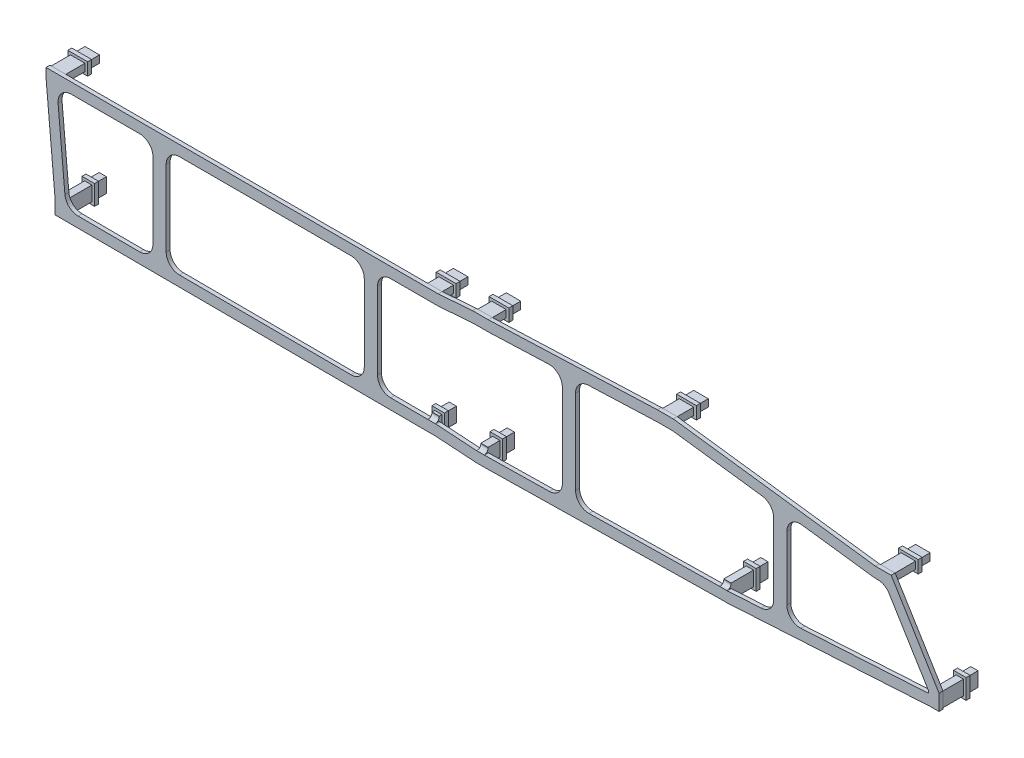
from build123d import *

# Parameters (mm, degrees)
STUD_LINK_DEPTH                  = 3
SKETCH1_W                        = 11
SKETCH1_H                        = 5.5
BOSS_EXTRUDE1_DEPTH              = 8
BOSS_EXTRUDE1_DIRECTION_2_REACH  = 398.6
SKETCH2_W                        = 11
SKETCH2_H                        = 5.5
BOSS_EXTRUDE2_DEPTH              = 8
BOSS_EXTRUDE2_DIRECTION_2_REACH  = 398.681
SKETCH3_W                        = 11
SKETCH3_H                        = 5.5
BOSS_EXTRUDE3_DEPTH              = 8
BOSS_EXTRUDE3_DIRECTION_2_REACH  = 398.771
SKETCH4_W                        = 5.5
SKETCH4_H                        = 11
BOSS_EXTRUDE4_DEPTH              = 8
BOSS_EXTRUDE4_DIRECTION_2_REACH  = 398.771
SKETCH5_W                        = 5.5
SKETCH5_H                        = 11
BOSS_EXTRUDE5_DEPTH              = 8
BOSS_EXTRUDE5_DIRECTION_2_REACH  = 398.6
SKETCH6_W                        = 5.5
SKETCH6_H                        = 11
BOSS_EXTRUDE6_DEPTH              = 8
BOSS_EXTRUDE6_DIRECTION_2_REACH  = 398.983
SKETCH7_W                        = 11
SKETCH7_H                        = 5.5
BOSS_EXTRUDE7_DEPTH              = 8
BOSS_EXTRUDE7_DIRECTION_2_REACH  = 398.926
SKETCH8_W                        = 5.5
SKETCH8_H                        = 11
BOSS_EXTRUDE8_DEPTH              = 8
BOSS_EXTRUDE8_DIRECTION_2_REACH  = 398.926
SKETCH9_W                        = 11
SKETCH9_H                        = 5.5
BOSS_EXTRUDE9_DEPTH              = 8
BOSS_EXTRUDE9_DIRECTION_2_REACH  = 398.872
BOSS_EXTRUDE10_DEPTH             = 22
BOSS_EXTRUDE10_DEPTH_BACK        = 8
SKETCH10_W                       = 5.5
SKETCH10_H                       = 11
SKETCH14_W                       = 15
SKETCH14_H                       = 9.5
BOSS_EXTRUDE14_DEPTH             = 3
SKETCH15_W                       = 15
SKETCH15_H                       = 9.5
BOSS_EXTRUDE15_DEPTH             = 3
SKETCH16_W                       = 15
SKETCH16_H                       = 9.5
BOSS_EXTRUDE16_DEPTH             = 3
SKETCH17_W                       = 9.5
SKETCH17_H                       = 15
BOSS_EXTRUDE17_DEPTH             = 3
SKETCH18_W                       = 9.5
SKETCH18_H                       = 15
BOSS_EXTRUDE18_DEPTH             = 3
SKETCH19_W                       = 9.5
SKETCH19_H                       = 15
BOSS_EXTRUDE19_DEPTH             = 3
SKETCH20_W                       = 15
SKETCH20_H                       = 9.5
BOSS_EXTRUDE20_DEPTH             = 3
SKETCH21_W                       = 9.5
SKETCH21_H                       = 15
BOSS_EXTRUDE21_DEPTH             = 3
SKETCH22_W                       = 15
SKETCH22_H                       = 9.5
BOSS_EXTRUDE22_DEPTH             = 3
SKETCH23_W                       = 9.5
SKETCH23_H                       = 15
BOSS_EXTRUDE23_DEPTH             = 3
CUT_EXTRUDE1_DEPTH               = 3
BOSS_EXTRUDE24_REACH             = 394.062
SKETCH25_W                       = 10
SKETCH25_H                       = 3
BOSS_EXTRUDE24_DIRECTION_2_REACH = 394.062
FILLET1_R                        = 3
FILLET2_R                        = 10


# Some blends are built 0.0001 mm under size
with BuildPart() as part:
    # Sketch13 → STUD LINK (new body)
    with BuildSketch(Plane.XY.offset(12)):
        Polygon((-277.75, -90), (-284.25, -90), (-284.25, -78), (-291, -3.25), (-291, 3.25), (-279, 3.25), (-6, 3.25), (6, 3.25), (32, 5.25), (44, 5.25), (172, 10.25), (184, 10.25), (337, -9.75), (349, -9.75), (385.25, -69), (385.25, -81), (378.75, -81), (225.25, -90), (218.75, -90), (41.25, -93), (34.75, -93), (4.25, -91), (-2.25, -91), align=None)
    extrude(amount=STUD_LINK_DEPTH)

    # Sketch1 → Boss-Extrude1 (add)
    with BuildSketch(Plane.XY):
        Rectangle(SKETCH1_W, SKETCH1_H)
    extrude(amount=-BOSS_EXTRUDE1_DEPTH)

    # Sketch1 → Boss-Extrude1 direction 2 (add, up to next)
    with BuildSketch(Plane.XY, mode=Mode.PRIVATE) as boss_extrude1_direction_2_sk1:
        Rectangle(SKETCH1_W, SKETCH1_H)
    boss_extrude1_direction_2_tool1 = extrude(boss_extrude1_direction_2_sk1.sketch, amount=BOSS_EXTRUDE1_DIRECTION_2_REACH, mode=Mode.PRIVATE) - part.part
    add(boss_extrude1_direction_2_tool1.solids().sort_by_distance((0, 0, 0))[0])


with BuildPart() as body_2:
    # Sketch2 → Boss-Extrude2 (new body)
    with BuildSketch(Plane.XY.offset(-2)):
        with Locations((38, 2)):
            Rectangle(SKETCH2_W, SKETCH2_H)
    extrude(amount=-BOSS_EXTRUDE2_DEPTH)


    # Sketch2 → Boss-Extrude2 direction 2 (add, up to next)
    with BuildSketch(Plane.XY.offset(-2), mode=Mode.PRIVATE) as boss_extrude2_direction_2_sk1:
        with Locations((38, 2)):
            Rectangle(SKETCH2_W, SKETCH2_H)
    boss_extrude2_direction_2_tool1 = extrude(boss_extrude2_direction_2_sk1.sketch, amount=BOSS_EXTRUDE2_DIRECTION_2_REACH, mode=Mode.PRIVATE) - part.part
    add(boss_extrude2_direction_2_tool1.solids().sort_by_distance((38, 2, -2))[0])



with BuildPart() as body_3:
    # Sketch3 → Boss-Extrude3 (new body)
    with BuildSketch(Plane.XY.offset(-4)):
        with Locations((178, 7)):
            Rectangle(SKETCH3_W, SKETCH3_H)
    extrude(amount=-BOSS_EXTRUDE3_DEPTH)


    # Sketch3 → Boss-Extrude3 direction 2 (add, up to next)
    with BuildSketch(Plane.XY.offset(-4), mode=Mode.PRIVATE) as boss_extrude3_direction_2_sk1:
        with Locations((178, 7)):
            Rectangle(SKETCH3_W, SKETCH3_H)
    boss_extrude3_direction_2_tool1 = extrude(boss_extrude3_direction_2_sk1.sketch, amount=BOSS_EXTRUDE3_DIRECTION_2_REACH, mode=Mode.PRIVATE) - part.part
    add(boss_extrude3_direction_2_tool1.solids().sort_by_distance((178, 7, -4))[0])



with BuildPart() as body_4:
    # Sketch4 → Boss-Extrude4 (new body)
    with BuildSketch(Plane.XY.offset(7)):
        with Locations((1, -85)):
            Rectangle(SKETCH4_W, SKETCH4_H)
    extrude(amount=-BOSS_EXTRUDE4_DEPTH)


    # Sketch4 → Boss-Extrude4 direction 2 (add, up to next)
    with BuildSketch(Plane.XY.offset(7), mode=Mode.PRIVATE) as boss_extrude4_direction_2_sk1:
        with Locations((1, -85)):
            Rectangle(SKETCH4_W, SKETCH4_H)
    boss_extrude4_direction_2_tool1 = extrude(boss_extrude4_direction_2_sk1.sketch, amount=BOSS_EXTRUDE4_DIRECTION_2_REACH, mode=Mode.PRIVATE) - part.part
    add(boss_extrude4_direction_2_tool1.solids().sort_by_distance((1, -85, 7))[0])



with BuildPart() as body_5:
    # Sketch5 → Boss-Extrude5 (new body)
    with BuildSketch(Plane.XY):
        with Locations((38, -87)):
            Rectangle(SKETCH5_W, SKETCH5_H)
    extrude(amount=-BOSS_EXTRUDE5_DEPTH)


    # Sketch5 → Boss-Extrude5 direction 2 (add, up to next)
    with BuildSketch(Plane.XY, mode=Mode.PRIVATE) as boss_extrude5_direction_2_sk1:
        with Locations((38, -87)):
            Rectangle(SKETCH5_W, SKETCH5_H)
    boss_extrude5_direction_2_tool1 = extrude(boss_extrude5_direction_2_sk1.sketch, amount=BOSS_EXTRUDE5_DIRECTION_2_REACH, mode=Mode.PRIVATE) - part.part
    add(boss_extrude5_direction_2_tool1.solids().sort_by_distance((38, -87, 0))[0])



with BuildPart() as body_6:
    # Sketch6 → Boss-Extrude6 (new body)
    with BuildSketch(Plane.XY.offset(-8)):
        with Locations((222, -84)):
            Rectangle(SKETCH6_W, SKETCH6_H)
    extrude(amount=-BOSS_EXTRUDE6_DEPTH)


    # Sketch6 → Boss-Extrude6 direction 2 (add, up to next)
    with BuildSketch(Plane.XY.offset(-8), mode=Mode.PRIVATE) as boss_extrude6_direction_2_sk1:
        with Locations((222, -84)):
            Rectangle(SKETCH6_W, SKETCH6_H)
    boss_extrude6_direction_2_tool1 = extrude(boss_extrude6_direction_2_sk1.sketch, amount=BOSS_EXTRUDE6_DIRECTION_2_REACH, mode=Mode.PRIVATE) - part.part
    add(boss_extrude6_direction_2_tool1.solids().sort_by_distance((222, -84, -8))[0])



with BuildPart() as body_7:
    # Sketch7 → Boss-Extrude7 (new body)
    with BuildSketch(Plane.XY.offset(-7)):
        with Locations((343, -13)):
            Rectangle(SKETCH7_W, SKETCH7_H)
    extrude(amount=-BOSS_EXTRUDE7_DEPTH)


    # Sketch7 → Boss-Extrude7 direction 2 (add, up to next)
    with BuildSketch(Plane.XY.offset(-7), mode=Mode.PRIVATE) as boss_extrude7_direction_2_sk1:
        with Locations((343, -13)):
            Rectangle(SKETCH7_W, SKETCH7_H)
    boss_extrude7_direction_2_tool1 = extrude(boss_extrude7_direction_2_sk1.sketch, amount=BOSS_EXTRUDE7_DIRECTION_2_REACH, mode=Mode.PRIVATE) - part.part
    add(boss_extrude7_direction_2_tool1.solids().sort_by_distance((343, -13, -7))[0])



with BuildPart() as body_8:
    # Sketch8 → Boss-Extrude8 (new body)
    with BuildSketch(Plane.XY.offset(-7)):
        with Locations((382, -75)):
            Rectangle(SKETCH8_W, SKETCH8_H)
    extrude(amount=-BOSS_EXTRUDE8_DEPTH)


    # Sketch8 → Boss-Extrude8 direction 2 (add, up to next)
    with BuildSketch(Plane.XY.offset(-7), mode=Mode.PRIVATE) as boss_extrude8_direction_2_sk1:
        with Locations((382, -75)):
            Rectangle(SKETCH8_W, SKETCH8_H)
    boss_extrude8_direction_2_tool1 = extrude(boss_extrude8_direction_2_sk1.sketch, amount=BOSS_EXTRUDE8_DIRECTION_2_REACH, mode=Mode.PRIVATE) - part.part
    add(boss_extrude8_direction_2_tool1.solids().sort_by_distance((382, -75, -7))[0])



with BuildPart() as body_9:
    # Sketch9 → Boss-Extrude9 (new body)
    with BuildSketch(Plane.XY.offset(-6)):
        with Locations((-285, 0)):
            Rectangle(SKETCH9_W, SKETCH9_H)
    extrude(amount=-BOSS_EXTRUDE9_DEPTH)


    # Sketch9 → Boss-Extrude9 direction 2 (add, up to next)
    with BuildSketch(Plane.XY.offset(-6), mode=Mode.PRIVATE) as boss_extrude9_direction_2_sk1:
        with Locations((-285, 0)):
            Rectangle(SKETCH9_W, SKETCH9_H)
    boss_extrude9_direction_2_tool1 = extrude(boss_extrude9_direction_2_sk1.sketch, amount=BOSS_EXTRUDE9_DIRECTION_2_REACH, mode=Mode.PRIVATE) - part.part
    add(boss_extrude9_direction_2_tool1.solids().sort_by_distance((-285, 0, -6))[0])



with BuildPart() as body_10:
    # Sketch10 → Boss-Extrude10 (new, two sides: drawn at the far end of the back side and taken through both)
    with BuildSketch(Plane.XY.offset(-10).offset(-BOSS_EXTRUDE10_DEPTH_BACK)):
        with Locations((-281, -84)):
            Rectangle(SKETCH10_W, SKETCH10_H)
    extrude(amount=BOSS_EXTRUDE10_DEPTH + BOSS_EXTRUDE10_DEPTH_BACK)



with BuildPart() as part_1:
    add(part.part)

    # Sketch14 → Boss-Extrude14 (add)
    with BuildSketch(Plane.XY):
        Rectangle(SKETCH14_W, SKETCH14_H)
    extrude(amount=BOSS_EXTRUDE14_DEPTH)


with BuildPart() as body_2_1:
    add(body_2.part)

    add(part_1.part)  # Boss-Extrude15 merges part
    # Sketch15 → Boss-Extrude15 (add)
    with BuildSketch(Plane.XY.offset(-2)):
        with Locations((38, 2)):
            Rectangle(SKETCH15_W, SKETCH15_H)
    extrude(amount=BOSS_EXTRUDE15_DEPTH)


with BuildPart() as body_3_1:
    add(body_3.part)

    add(body_2_1.part)  # Boss-Extrude16 merges body 2
    # Sketch16 → Boss-Extrude16 (add)
    with BuildSketch(Plane.XY.offset(-4)):
        with Locations((178, 7)):
            Rectangle(SKETCH16_W, SKETCH16_H)
    extrude(amount=BOSS_EXTRUDE16_DEPTH)


with BuildPart() as body_4_1:
    add(body_4.part)

    add(body_3_1.part)  # Boss-Extrude17 merges body 3
    # Sketch17 → Boss-Extrude17 (add)
    with BuildSketch(Plane.XY.offset(7)):
        with Locations((1, -85)):
            Rectangle(SKETCH17_W, SKETCH17_H)
    extrude(amount=BOSS_EXTRUDE17_DEPTH)


with BuildPart() as body_5_1:
    add(body_5.part)

    add(body_4_1.part)  # Boss-Extrude18 merges body 4
    # Sketch18 → Boss-Extrude18 (add)
    with BuildSketch(Plane.XY):
        with Locations((38, -87)):
            Rectangle(SKETCH18_W, SKETCH18_H)
    extrude(amount=BOSS_EXTRUDE18_DEPTH)


with BuildPart() as body_6_1:
    add(body_6.part)

    add(body_5_1.part)  # Boss-Extrude19 merges body 5
    # Sketch19 → Boss-Extrude19 (add)
    with BuildSketch(Plane.XY.offset(-8)):
        with Locations((222, -84)):
            Rectangle(SKETCH19_W, SKETCH19_H)
    extrude(amount=BOSS_EXTRUDE19_DEPTH)


with BuildPart() as body_7_1:
    add(body_7.part)

    add(body_6_1.part)  # Boss-Extrude20 merges body 6
    # Sketch20 → Boss-Extrude20 (add)
    with BuildSketch(Plane.XY.offset(-7)):
        with Locations((343, -13)):
            Rectangle(SKETCH20_W, SKETCH20_H)
    extrude(amount=BOSS_EXTRUDE20_DEPTH)


with BuildPart() as body_8_1:
    add(body_8.part)

    add(body_7_1.part)  # Boss-Extrude21 merges body 7
    # Sketch21 → Boss-Extrude21 (add)
    with BuildSketch(Plane.XY.offset(-7)):
        with Locations((382, -75)):
            Rectangle(SKETCH21_W, SKETCH21_H)
    extrude(amount=BOSS_EXTRUDE21_DEPTH)


with BuildPart() as body_9_1:
    add(body_9.part)

    add(body_8_1.part)  # Boss-Extrude22 merges body 8
    # Sketch22 → Boss-Extrude22 (add)
    with BuildSketch(Plane.XY.offset(-6)):
        with Locations((-285, 0)):
            Rectangle(SKETCH22_W, SKETCH22_H)
    extrude(amount=BOSS_EXTRUDE22_DEPTH)


with BuildPart() as body_10_1:
    add(body_10.part)

    add(body_9_1.part)  # Boss-Extrude23 merges body 9
    # Sketch23 → Boss-Extrude23 (add)
    with BuildSketch(Plane.XY.offset(-10)):
        with Locations((-281, -84)):
            Rectangle(SKETCH23_W, SKETCH23_H)
    extrude(amount=BOSS_EXTRUDE23_DEPTH)

    # Sketch24 → Cut-Extrude1 (cut)
    with BuildSketch(Plane.XY.offset(15)):
        Polygon((-276.25, -82.005391946), (-2.235480992, -83), (4.512013725, -83), (35.012013725, -85), (41.182399194, -85), (218.682399194, -82), (225.015673526, -82), (377.25, -73.074208871), (377.25, -71.253135578), (344.516014098, -17.75), (336.479338954, -17.75), (183.479338954, 2.25), (172.156190441, 2.25), (44.156190441, -2.75), (32.307238483, -2.75), (6.307238483, -4.75), (-282.831997633, -4.75), (-276.25, -77.639529339), align=None)
    extrude(amount=-CUT_EXTRUDE1_DEPTH, mode=Mode.SUBTRACT)

    # Sketch25 → Boss-Extrude24 (add, up to next)
    with BuildSketch(Plane(origin=(0, -50, 0), x_dir=(1, 0, 0), z_dir=(0, 1, 0)), mode=Mode.PRIVATE) as boss_extrude24_sk1:
        with Locations((-205, -13.5)):
            Rectangle(SKETCH25_W, SKETCH25_H)
    boss_extrude24_tool1 = extrude(boss_extrude24_sk1.sketch, amount=BOSS_EXTRUDE24_REACH, mode=Mode.PRIVATE) - body_10_1.part
    # Sketch25 → Boss-Extrude24 (add, up to next)
    with BuildSketch(Plane(origin=(0, -50, 0), x_dir=(1, 0, 0), z_dir=(0, 1, 0)), mode=Mode.PRIVATE) as boss_extrude24_sk2:
        with Locations((-45, -13.5)):
            Rectangle(SKETCH25_W, SKETCH25_H)
    boss_extrude24_tool2 = extrude(boss_extrude24_sk2.sketch, amount=BOSS_EXTRUDE24_REACH, mode=Mode.PRIVATE) - body_10_1.part
    # Sketch25 → Boss-Extrude24 (add, up to next)
    with BuildSketch(Plane(origin=(0, -50, 0), x_dir=(1, 0, 0), z_dir=(0, 1, 0)), mode=Mode.PRIVATE) as boss_extrude24_sk3:
        with Locations((105, -13.5)):
            Rectangle(SKETCH25_W, SKETCH25_H)
    boss_extrude24_tool3 = extrude(boss_extrude24_sk3.sketch, amount=BOSS_EXTRUDE24_REACH, mode=Mode.PRIVATE) - body_10_1.part
    # Sketch25 → Boss-Extrude24 (add, up to next)
    with BuildSketch(Plane(origin=(0, -50, 0), x_dir=(1, 0, 0), z_dir=(0, 1, 0)), mode=Mode.PRIVATE) as boss_extrude24_sk4:
        with Locations((265, -13.5)):
            Rectangle(SKETCH25_W, SKETCH25_H)
    boss_extrude24_tool4 = extrude(boss_extrude24_sk4.sketch, amount=BOSS_EXTRUDE24_REACH, mode=Mode.PRIVATE) - body_10_1.part
    add(boss_extrude24_tool1.solids().sort_by_distance((-205, -50, 13.5))[0])
    add(boss_extrude24_tool2.solids().sort_by_distance((-45, -50, 13.5))[0])
    add(boss_extrude24_tool3.solids().sort_by_distance((105, -50, 13.5))[0])
    add(boss_extrude24_tool4.solids().sort_by_distance((265, -50, 13.5))[0])

    # Sketch25 → Boss-Extrude24 direction 2 (add, up to next)
    with BuildSketch(Plane(origin=(0, -50, 0), x_dir=(1, 0, 0), z_dir=(0, 1, 0)), mode=Mode.PRIVATE) as boss_extrude24_direction_2_sk1:
        with Locations((-205, -13.5)):
            Rectangle(SKETCH25_W, SKETCH25_H)
    boss_extrude24_direction_2_tool1 = extrude(boss_extrude24_direction_2_sk1.sketch, amount=-BOSS_EXTRUDE24_DIRECTION_2_REACH, mode=Mode.PRIVATE) - body_10_1.part
    # Sketch25 → Boss-Extrude24 direction 2 (add, up to next)
    with BuildSketch(Plane(origin=(0, -50, 0), x_dir=(1, 0, 0), z_dir=(0, 1, 0)), mode=Mode.PRIVATE) as boss_extrude24_direction_2_sk2:
        with Locations((-45, -13.5)):
            Rectangle(SKETCH25_W, SKETCH25_H)
    boss_extrude24_direction_2_tool2 = extrude(boss_extrude24_direction_2_sk2.sketch, amount=-BOSS_EXTRUDE24_DIRECTION_2_REACH, mode=Mode.PRIVATE) - body_10_1.part
    # Sketch25 → Boss-Extrude24 direction 2 (add, up to next)
    with BuildSketch(Plane(origin=(0, -50, 0), x_dir=(1, 0, 0), z_dir=(0, 1, 0)), mode=Mode.PRIVATE) as boss_extrude24_direction_2_sk3:
        with Locations((105, -13.5)):
            Rectangle(SKETCH25_W, SKETCH25_H)
    boss_extrude24_direction_2_tool3 = extrude(boss_extrude24_direction_2_sk3.sketch, amount=-BOSS_EXTRUDE24_DIRECTION_2_REACH, mode=Mode.PRIVATE) - body_10_1.part
    # Sketch25 → Boss-Extrude24 direction 2 (add, up to next)
    with BuildSketch(Plane(origin=(0, -50, 0), x_dir=(1, 0, 0), z_dir=(0, 1, 0)), mode=Mode.PRIVATE) as boss_extrude24_direction_2_sk4:
        with Locations((265, -13.5)):
            Rectangle(SKETCH25_W, SKETCH25_H)
    boss_extrude24_direction_2_tool4 = extrude(boss_extrude24_direction_2_sk4.sketch, amount=-BOSS_EXTRUDE24_DIRECTION_2_REACH, mode=Mode.PRIVATE) - body_10_1.part
    add(boss_extrude24_direction_2_tool1.solids().sort_by_distance((-205, -50, 13.5))[0])
    add(boss_extrude24_direction_2_tool2.solids().sort_by_distance((-45, -50, 13.5))[0])
    add(boss_extrude24_direction_2_tool3.solids().sort_by_distance((105, -50, 13.5))[0])
    add(boss_extrude24_direction_2_tool4.solids().sort_by_distance((265, -50, 13.5))[0])

    # Fillet1
    # the kernel refuses this fillet: 3 mm, written as the material it adds along each edge
    with BuildSketch(Plane(origin=(219.25, -82, 12), x_dir=(0, 1, 0), z_dir=(1, 0, 0)), Plane(origin=(-1.75, -83, 12), x_dir=(0, 1, 0), z_dir=(1, 0, 0)), Plane(origin=(35.25, -85, 12), x_dir=(0, 1, 0), z_dir=(1, 0, 0))) as fillet1_piece_1:
        with BuildLine():
            CenterArc((FILLET1_R, FILLET1_R), FILLET1_R, 180, 90)
            Line((0, FILLET1_R), (0, 0))
            Line((0, 0), (FILLET1_R, 0))
        make_face()
    extrude(amount=5.5)

    # Fillet2
    fillet2_edges = [body_10_1.edges().sort_by_distance(p)[0] for p in [
        (-210, -82.245863815, 13.5),
        (-210, -4.75, 13.5),
        (-282.831997633, -4.75, 13.5),
        (-276.25, -82.005391946, 13.5),
        (100, -84.005899705, 13.5),
        (100, -0.568601189, 13.5),
        (-50, -4.75, 13.5),
        (-50, -82.826626065, 13.5),
        (-40, -82.862923706, 13.5),
        (-200, -82.282161456, 13.5),
        (-200, -4.75, 13.5),
        (-40, -4.75, 13.5),
        (110, -0.177976189, 13.5),
        (110, -83.83688562, 13.5),
        (270, -79.362482487, 13.5),
        (260, -79.948801705, 13.5),
        (260, -7.75270079, 13.5),
        (270, -9.059890333, 13.5),
        (336.479338954, -17.75, 13.5),
        (344.516014098, -17.75, 13.5),
    ]]
    fillet(fillet2_edges, radius=FILLET2_R - 0.0001)  # a hair under: the kernel refuses the full size


solid = body_10_1.part
